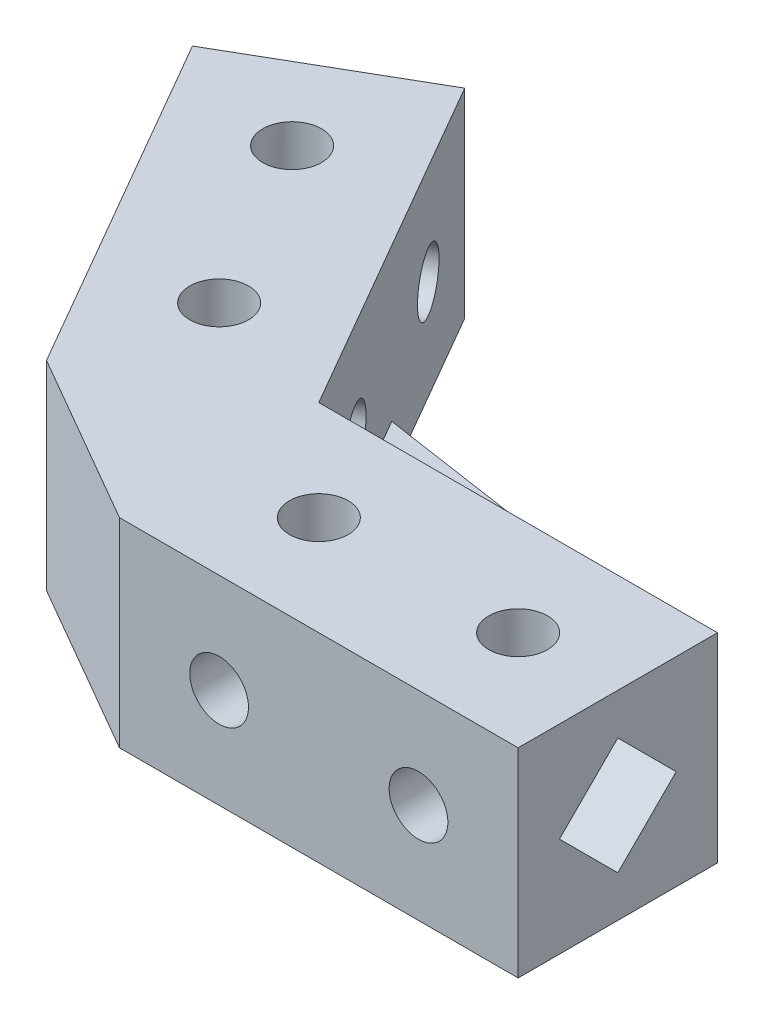
from build123d import *

# Parameters (mm, degrees)
SKETCH1_W           = 34
SKETCH1_H           = 17
SKETCH1_R           = 2.505
BOSS_EXTRUDE1_DEPTH = 17
SKETCH6_OUTSIDE_W   = 44.328
SKETCH6_OUTSIDE_H   = 27.328
SKETCH6_OUTSIDE_W_2 = 34
SKETCH6_OUTSIDE_H_2 = 17
SKETCH6_OUTSIDE_R   = 2.505
CUT_EXTRUDE10_DEPTH = 42.641325627
SKETCH7_OUTSIDE_W   = 27.328
SKETCH7_OUTSIDE_H   = 27.328
SKETCH7_OUTSIDE_W_2 = 17
SKETCH7_OUTSIDE_H_2 = 17
CUT_EXTRUDE11_DEPTH = 34
BOSS_EXTRUDE2_DEPTH = 17
SKETCH13_R          = 2.505
BOSS_EXTRUDE3_DEPTH = 4


with BuildPart() as part:
    # sketch1 → Boss-Extrude1 (new body)
    with BuildSketch(Plane(origin=(0, 0, 0), x_dir=(1, 0, 0), z_dir=(0, 1, 0))):
        with Locations((17, -8.5)):
            Rectangle(SKETCH1_W, SKETCH1_H)
        with Locations((8.5, -8.5)):
            Circle(SKETCH1_R, mode=Mode.SUBTRACT)
        with Locations((25.5, -8.5)):
            Circle(SKETCH1_R, mode=Mode.SUBTRACT)
    extrude(amount=BOSS_EXTRUDE1_DEPTH)

    # Sketch6 outside → Cut-Extrude10 (cut, through all)
    # profile 1 of 3: a face of its own
    with BuildSketch(Plane(origin=(0, 0, 0), x_dir=(-1, 0, 0), z_dir=(0, 0, -1))):
        with Locations((-17, 8.5)):
            Rectangle(SKETCH6_OUTSIDE_W, SKETCH6_OUTSIDE_H)
        with Locations((-17, 8.5)):
            Rectangle(SKETCH6_OUTSIDE_W_2, SKETCH6_OUTSIDE_H_2, mode=Mode.SUBTRACT)
    # profile 2 of 3: a face of its own
    with BuildSketch(Plane(origin=(0, 0, 0), x_dir=(-1, 0, 0), z_dir=(0, 0, -1))):
        with Locations((-25.5, 8.5)):
            Circle(SKETCH6_OUTSIDE_R)
    # profile 3 of 3: a face of its own
    with BuildSketch(Plane(origin=(0, 0, 0), x_dir=(-1, 0, 0), z_dir=(0, 0, -1))):
        with Locations((-8.5, 8.5)):
            Circle(SKETCH6_OUTSIDE_R)
    extrude(amount=-CUT_EXTRUDE10_DEPTH, mode=Mode.SUBTRACT)

    # Sketch7 outside → Cut-Extrude11 (cut)
    # profile 1 of 2: a face of its own
    with BuildSketch(Plane(origin=(34, 0, 0), x_dir=(0, 0, -1), z_dir=(1, 0, 0))):
        with Locations((-8.5, 8.5)):
            Rectangle(SKETCH7_OUTSIDE_W, SKETCH7_OUTSIDE_H)
        with Locations((-8.5, 8.5)):
            Rectangle(SKETCH7_OUTSIDE_W_2, SKETCH7_OUTSIDE_H_2, mode=Mode.SUBTRACT)
    # profile 2 of 2: a face of its own
    with BuildSketch(Plane(origin=(34, 0, 0), x_dir=(0, 0, -1), z_dir=(1, 0, 0))):
        Polygon((-8.5, 13.47803174), (-3.52196826, 8.5), (-8.5, 3.52196826), (-13.47803174, 8.5), align=None)
    extrude(amount=-CUT_EXTRUDE11_DEPTH, mode=Mode.SUBTRACT)


with BuildPart() as body_2:
    # Mirror6: mirrored copy
    add(part.part.mirror(Plane(origin=(0, 0, 0), x_dir=(-0.49999999999999784, 0, 0.8660254037844399), z_dir=(-0.8660254037844399, 0, -0.49999999999999784))))


with BuildPart() as part_1:
    add(part.part)

    add(body_2.part)  # Boss-Extrude2 merges body 2
    # Sketch11 → Boss-Extrude2 (add)
    with BuildSketch(Plane(origin=(0, 0, 0), x_dir=(1, 0, 0), z_dir=(0, 1, 0))):
        Polygon((-14.722431864, -8.5), (0, -17), (0, 0), align=None)
    extrude(amount=BOSS_EXTRUDE2_DEPTH)

    # Sketch13 → Boss-Extrude3 (add)
    with BuildSketch(Plane(origin=(0, 0, 0), x_dir=(1, 0, 0), z_dir=(0, 1, 0))):
        Polygon((7.152847248, 12.389094852), (-8.5, 14.722431864), (0, 0), (17, 0), align=None)
        with Locations((4.652847248, 8.058967833)):
            Circle(SKETCH13_R, mode=Mode.SUBTRACT)
    extrude(amount=BOSS_EXTRUDE3_DEPTH)


solid = part_1.part
